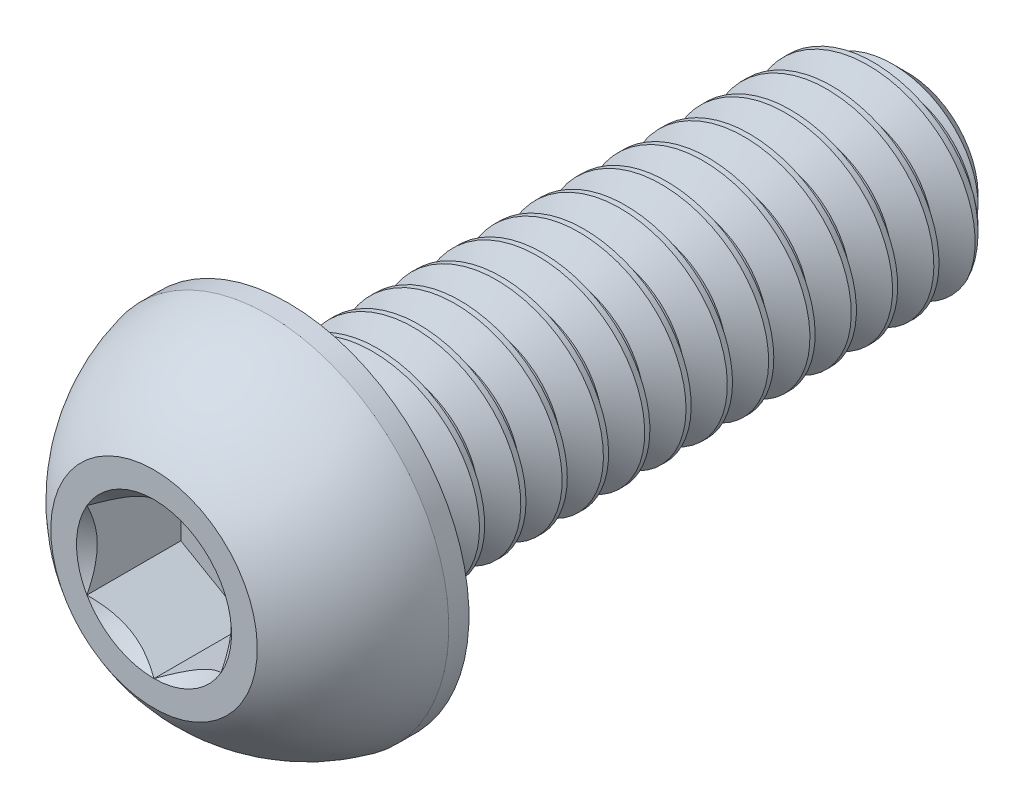
from build123d import *

# Parameters (mm, degrees)
CUT_EXTRUDE1_DEPTH = 0.91
CUT_SWEEP1_PITCH   = 0.4


# Read off the part's stored shape, not the designer's step: Split1, Boss-Extrude1
with BuildPart() as part:
    # Sketch2 → Revolve1 (revolve)
    with BuildSketch(Plane(origin=(0, 0, 0), x_dir=(0, 0, -1), z_dir=(1, 0, 0)), mode=Mode.PRIVATE) as revolve1_sk:
        with BuildLine():
            Line((-3.65, 0), (3.65, 0))
            Line((3.65, 0), (3.65, 0.68))
            Line((3.65, 0.68), (3.33, 1))
            Line((3.33, 1), (-2.35, 1))
            Line((-2.35, 1), (-2.35, 1.75))
            Line((-2.35, 1.75), (-2.545, 1.75))
            ThreePointArc((-2.545, 1.75), (-3.170023043, 1.481850617), (-3.65, 1))
            Line((-3.65, 1), (-3.65, 0))
        make_face()
    revolve(revolve1_sk.sketch.rotate(Axis((0, 0, 3.65), (0, 0, -1)), 180), axis=Axis((0, 0, 3.65), (0, 0, -1)))

    # Sketch3 → Cut-Extrude1 (cut)
    with BuildSketch(Plane.XY.offset(3.65)):
        Polygon((0, 0.75055535), (-0.65, 0.375277675), (-0.65, -0.375277675), (0, -0.75055535), (0.65, -0.375277675), (0.65, 0.375277675), align=None)
    extrude(amount=-CUT_EXTRUDE1_DEPTH, mode=Mode.SUBTRACT)

    # Cut-Extrude2 cone 1 section (through the dimple's axis) → Cut-Extrude2 (revolve, cut)
    with BuildSketch(Plane(origin=(0, 0, 3.65), x_dir=(0, -1, 0), z_dir=(1, 0, 0))):
        Polygon((0, 0), (0.75055535, 0), (0, 0.75055535), align=None)
    revolve(axis=Axis((0, 0, 3.65), (0, 0, -1)), mode=Mode.SUBTRACT)


with BuildPart() as body_2:
    # Split1: the piece on the far side of the plane
    add(part.part)
    split(bisect_by=Plane.XY.offset(2.35), keep=Keep.BOTTOM)

    # Cut-Sweep1: the profile of Sketch6 screwed along a right-hand helix of 16 turns, 6 arcs to a turn; built about Z, then put on its axis
    cut_sweep1_z = Axis((0, 0, 0), (0, 0, 1))
    cut_sweep1_corners = [(0.740192379, 0, -0.15), (0.740192379, 0, -0.2), (1.021650635, 0, -0.3625), (1.021650635, 0, 0.0125)]
    with BuildLine(mode=Mode.PRIVATE) as cut_sweep1_profile:
        Line(cut_sweep1_corners[0], cut_sweep1_corners[1])
        Line(cut_sweep1_corners[1], cut_sweep1_corners[2])
        Line(cut_sweep1_corners[2], cut_sweep1_corners[3])
        Line(cut_sweep1_corners[3], cut_sweep1_corners[0])
    cut_sweep1_cap = Face(cut_sweep1_profile.wire())
    cut_sweep1_turn_angles = [0, 30, 60, 90, 120, 150, 180, 210, 240, 270, 300, 330, 360]
    cut_sweep1_turn_weights = [1, 0.8660254037844387, 1, 0.8660254037844387, 1, 0.8660254037844387, 1, 0.8660254037844387, 1, 0.8660254037844387, 1, 0.8660254037844387, 1]
    cut_sweep1_turn_rails = [Edge.make_bspline([Vector(p[0], p[1], 0).rotate(cut_sweep1_z, cut_sweep1_turn_angles[k]) / cut_sweep1_turn_weights[k] + Vector(0, 0, p[2] + CUT_SWEEP1_PITCH * cut_sweep1_turn_angles[k] / 360) for k in range(13)], [0, 0, 0, 1, 1, 2, 2, 3, 3, 4, 4, 5, 5, 6, 6, 6], 2, cut_sweep1_turn_weights) for p in cut_sweep1_corners]
    cut_sweep1_turn_sides = [Face.make_surface_from_curves(cut_sweep1_turn_rails[p[0]], cut_sweep1_turn_rails[p[1]]) for p in [(0, 1), (1, 2), (2, 3), (3, 0)]]
    cut_sweep1_turn = Solid(Shell([*cut_sweep1_turn_sides, cut_sweep1_cap, cut_sweep1_cap.rotate(cut_sweep1_z, 360).moved(Location((0, 0, CUT_SWEEP1_PITCH * 360 / 360)))]))
    cut_sweep1_each = [*[cut_sweep1_turn.moved(Location((0, 0, CUT_SWEEP1_PITCH * i))) for i in range(16)]]
    add(Plane(origin=(0, 0, -3.65), x_dir=(0, 1, 0), z_dir=(0, 0, 1)) * Compound([cut_sweep1_each[i] for i in range(0, 16, 2)]), mode=Mode.SUBTRACT)
    add(Plane(origin=(0, 0, -3.65), x_dir=(0, 1, 0), z_dir=(0, 0, 1)) * Compound([cut_sweep1_each[i] for i in range(1, 16, 2)]), mode=Mode.SUBTRACT)


with BuildPart() as part_1:
    add(part.part)

    # Split1
    split(bisect_by=Plane.XY.offset(2.35), keep=Keep.TOP)

    add(body_2.part)  # Boss-Extrude1 merges body 2
    # Boss-Extrude1 outline → Boss-Extrude1 (revolve)
    with BuildSketch(Plane.XZ):
        Polygon((0.740190996, 2.35), (0.740190996, 1.899997606), (1, 2.35), align=None)
    revolve(axis=Axis((0, 0, 0), (0, 0, 1)))


solid = part_1.part
